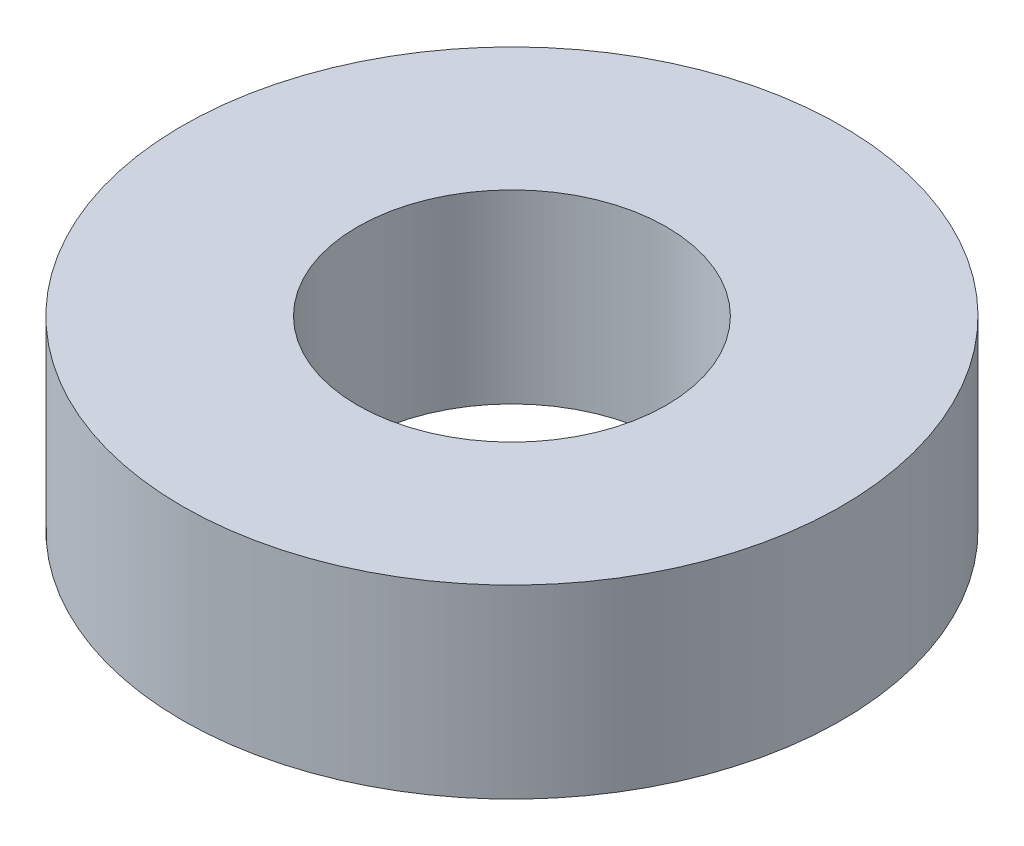
from build123d import *

# Parameters (mm, degrees)
SKETCH1_R           = 16
SKETCH1_R_2         = 7.5
BOSS_EXTRUDE1_DEPTH = 9


with BuildPart() as part:
    # Sketch1 → Boss-Extrude1 (new body)
    with BuildSketch(Plane(origin=(0, 0, 0), x_dir=(1, 0, 0), z_dir=(0, 1, 0))):
        Circle(SKETCH1_R)
        Circle(SKETCH1_R_2, mode=Mode.SUBTRACT)
    extrude(amount=BOSS_EXTRUDE1_DEPTH)


solid = part.part
